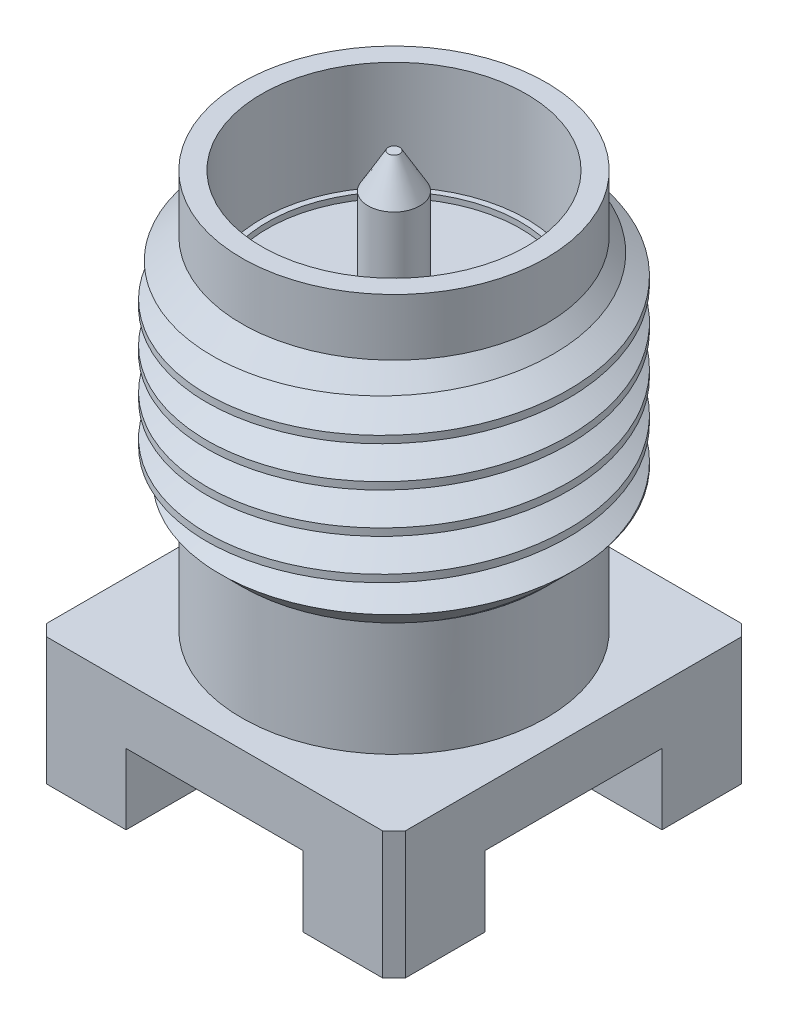
from build123d import *

# Parameters (mm, degrees)
EXTRUDE_1_DEPTH     = 1
SWEEP_1_PITCH       = 0.705
BOSS_EXTRUDE1_DEPTH = 1.24
CIRPATTERN1_COUNT   = 4


with BuildPart() as part:
    # Эскиз1 → Повернуть1 (revolve)
    with BuildSketch(Plane.XY, mode=Mode.PRIVATE) as revolve_1_sk:
        Polygon((-2.675, 2.27), (-2.675, 4.27), (-3.175, 4.77), (-3.175, 7.77), (-2.675, 8.27), (-2.675, 9.27), (-2.325, 9.27), (-2.325, 7.37), (-2.225, 7.37), (-2.225, 7.27), (-0.455, 7.27), (-0.455, 8.955121963), (-0.1, 9.57), (0, 9.57), (0, 6.9), (0, 0), (-0.635, 0), (-0.635, 2.27), align=None)
    revolve(revolve_1_sk.sketch.rotate(Axis((0, -1000, 0), (0, 1, 0)), 180), axis=Axis((0, -1000, 0), (0, 1, 0)))

    # Эскиз2 → Бобышка-Вытянуть1 (add)
    with BuildSketch(Plane.XZ.offset(-2.27)):
        Polygon((2.955, -3.155), (3.155, -2.955), (3.155, 2.955), (2.955, 3.155), (-2.955, 3.155), (-3.155, 2.955), (-3.155, -2.955), (-2.955, -3.155), align=None)
    extrude(amount=EXTRUDE_1_DEPTH)

    # Вырез-По траектории1: the profile of Эскиз6 screwed along a right-hand helix of 8 turns, 6 arcs to a turn; built about Z, then put on its axis
    sweep_1_z = Axis((0, 0, 0), (0, 0, 1))
    sweep_1_corners = [(2.675, 0, 0), (3.675, 0, 0.577350269), (3.675, 0, -0.577350269)]
    with BuildLine(mode=Mode.PRIVATE) as sweep_1_profile:
        Line(sweep_1_corners[0], sweep_1_corners[1])
        Line(sweep_1_corners[1], sweep_1_corners[2])
        Line(sweep_1_corners[2], sweep_1_corners[0])
    sweep_1_cap = Face(sweep_1_profile.wire())
    sweep_1_turn_angles = [0, 30, 60, 90, 120, 150, 180, 210, 240, 270, 300, 330, 360]
    sweep_1_turn_weights = [1, 0.8660254037844387, 1, 0.8660254037844387, 1, 0.8660254037844387, 1, 0.8660254037844387, 1, 0.8660254037844387, 1, 0.8660254037844387, 1]
    sweep_1_turn_rails = [Edge.make_bspline([Vector(p[0], p[1], 0).rotate(sweep_1_z, sweep_1_turn_angles[k]) / sweep_1_turn_weights[k] + Vector(0, 0, p[2] + SWEEP_1_PITCH * sweep_1_turn_angles[k] / 360) for k in range(13)], [0, 0, 0, 1, 1, 2, 2, 3, 3, 4, 4, 5, 5, 6, 6, 6], 2, sweep_1_turn_weights) for p in sweep_1_corners]
    sweep_1_turn_sides = [Face.make_surface_from_curves(sweep_1_turn_rails[p[0]], sweep_1_turn_rails[p[1]]) for p in [(0, 1), (1, 2), (2, 0)]]
    sweep_1 = Plane(origin=(0, 9.27, 0), x_dir=(1, 0, 0), z_dir=(0, -1, 0)) * Solid(Shell([*[p.moved(Location((0, 0, SWEEP_1_PITCH * i))) for i in range(8) for p in sweep_1_turn_sides], sweep_1_cap, sweep_1_cap.rotate(sweep_1_z, 2880).moved(Location((0, 0, SWEEP_1_PITCH * 2880 / 360)))]))
    add(sweep_1, mode=Mode.SUBTRACT)

    # Sketch1 → Boss-Extrude1 (add)
    with BuildSketch(Plane(origin=(0, 1.27, 0), x_dir=(-1, 0, 0), z_dir=(0, -1, 0))):
        Polygon((1.5548, -3.155), (1.5548, -1.5548), (3.155, -1.5548), (3.155, -2.955), (2.955, -3.155), align=None)
    boss_extrude1 = extrude(amount=BOSS_EXTRUDE1_DEPTH)

    # CirPattern1: Boss-Extrude1 ×4 about axis
    cirpattern1_axis = Axis((0, 0, 0), (0, 1, 0))
    for i in range(1, CIRPATTERN1_COUNT):
        add(boss_extrude1.rotate(cirpattern1_axis, i * 360 / CIRPATTERN1_COUNT))


solid = part.part
